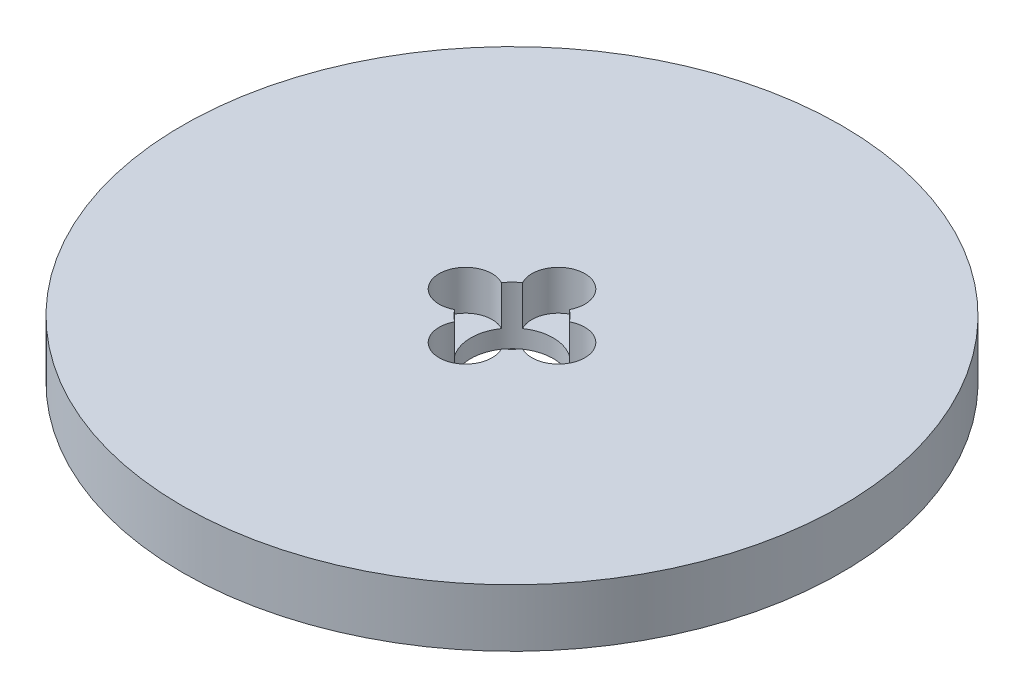
from build123d import *

# Parameters (mm, degrees)
SKETCH1_R           = 80
BOSS_EXTRUDE1_DEPTH = 14
SKETCH2_R           = 10
CUT_EXTRUDE1_DEPTH  = 115
SKETCH3_R           = 6.430168916
CUT_EXTRUDE2_DEPTH  = 9.646955961
CIRPATTERN1_COUNT   = 4


with BuildPart() as part:
    # Sketch1 → Boss-Extrude1 (new body)
    with BuildSketch(Plane(origin=(0, 0, 0), x_dir=(1, 0, 0), z_dir=(0, 1, 0))):
        Circle(SKETCH1_R)
    extrude(amount=BOSS_EXTRUDE1_DEPTH)

    # Sketch2 → Cut-Extrude1 (cut, through all)
    with BuildSketch(Plane(origin=(0, 0, 0), x_dir=(1, 0, 0), z_dir=(0, 1, 0))):
        Circle(SKETCH2_R)
    extrude(amount=CUT_EXTRUDE1_DEPTH, mode=Mode.SUBTRACT)

    # Sketch3 → Cut-Extrude2 (cut)
    with BuildSketch(Plane(origin=(0, 14, 0), x_dir=(1, 0, 0), z_dir=(0, 1, 0))):
        with Locations((-11.262205768, 0)):
            Circle(SKETCH3_R)
    cut_extrude2 = extrude(amount=-CUT_EXTRUDE2_DEPTH, mode=Mode.SUBTRACT)

    # CirPattern1: Cut-Extrude2 ×4 about axis
    cirpattern1_axis = Axis((0, 0, 0), (0, 1, 0))
    for i in range(1, CIRPATTERN1_COUNT):
        add(cut_extrude2.rotate(cirpattern1_axis, i * 360 / CIRPATTERN1_COUNT), mode=Mode.SUBTRACT)


solid = part.part
